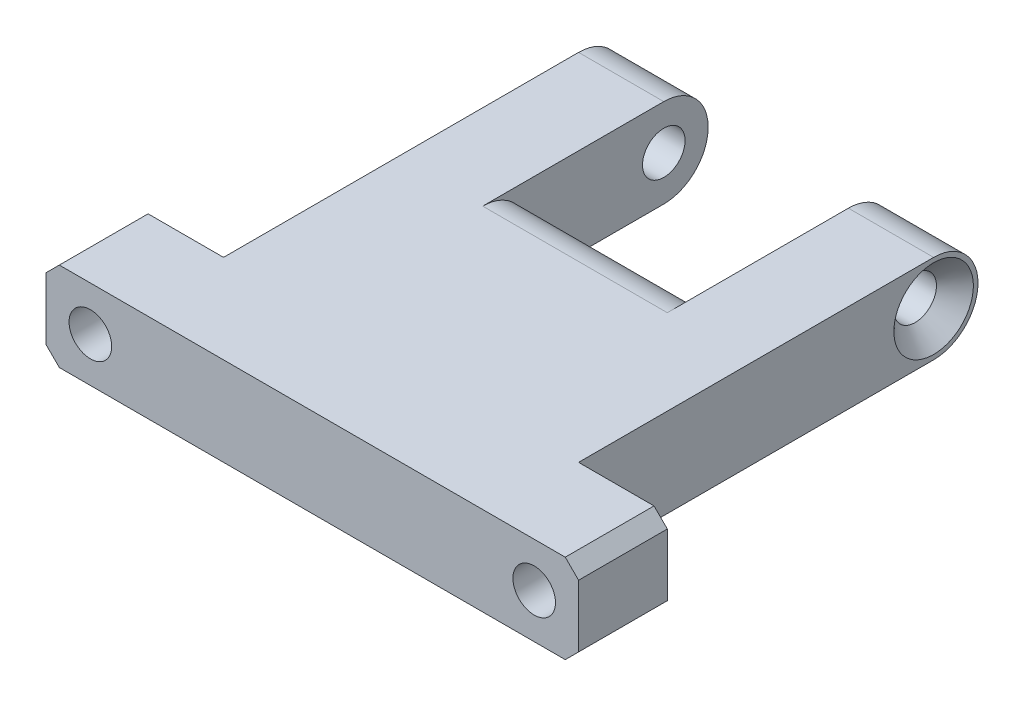
from build123d import *

# Parameters (mm, degrees)
BOSS_EXTRUDE1_DEPTH           = 10
FILLET1_R                     = 5
CHAMFER1_SIZE                 = 1.5
CSK_FOR_M4_SFHCS1_D           = 4.8
CSK_FOR_M4_SFHCS1_CSINK_D     = 8.96
CSK_FOR_M4_SFHCS1_CSINK_ANGLE = 90
CSK_FOR_M4_SFHCS2_D           = 4.8
CSK_FOR_M4_SFHCS2_DEPTH       = 9.6
CSK_FOR_M4_SFHCS2_CSINK_D     = 8.96
CSK_FOR_M4_SFHCS2_CSINK_ANGLE = 90


with BuildPart() as part:
    # Sketch1 → Boss-Extrude1 (new body)
    with BuildSketch(Plane(origin=(0, 0, 0), x_dir=(1, 0, 0), z_dir=(0, 1, 0))):
        Polygon((-30, -17.5), (-30, -27.5), (30, -27.5), (30, -17.5), (20, -17.5), (20, 27.5), (10.4, 27.5), (10.4, 7.1), (-10.4, 7.1), (-10.4, 27.5), (-20, 27.5), (-20, -17.5), align=None)
    extrude(amount=BOSS_EXTRUDE1_DEPTH)

    # Fillet1
    fillet1_edges = [part.edges().sort_by_distance(p)[0] for p in [
        (-15.2, 0, -27.5),
        (15.2, 0, -27.5),
        (-15.2, 10, -27.5),
        (15.2, 10, -27.5),
        (0, 10, -7.1),
        (0, 0, -7.1),
    ]]
    fillet(fillet1_edges, radius=FILLET1_R - 0.0001)  # a hair under: the kernel refuses the full size

    # Chamfer1
    chamfer1_edges = [part.edges().sort_by_distance(p)[0] for p in [
        (30, 0, 22.5),
        (-30, 0, 22.5),
        (-30, 10, 22.5),
        (30, 10, 22.5),
    ]]
    chamfer(chamfer1_edges, length=CHAMFER1_SIZE)

    # CSK for M4 SFHCS1 (through all)
    with Locations(Plane(origin=(0, 0, 17.5), x_dir=(-1, 0, 0), z_dir=(0, 0, -1))):
        with Locations((-25, 5), (25, 5)):
            CounterSinkHole(CSK_FOR_M4_SFHCS1_D / 2, CSK_FOR_M4_SFHCS1_CSINK_D / 2, counter_sink_angle=CSK_FOR_M4_SFHCS1_CSINK_ANGLE)

    # CSK for M4 SFHCS2
    with Locations(Plane.ZY.offset(20)):
        with Locations((-22.5, 5)):
            csk_for_m4_sfhcs2 = CounterSinkHole(CSK_FOR_M4_SFHCS2_D / 2, CSK_FOR_M4_SFHCS2_CSINK_D / 2, depth=CSK_FOR_M4_SFHCS2_DEPTH, counter_sink_angle=CSK_FOR_M4_SFHCS2_CSINK_ANGLE)

    # Mirror1: CSK for M4 SFHCS2 across plane
    add(csk_for_m4_sfhcs2.mirror(Plane(origin=(0, 0, 0), x_dir=(0, 0, 1), z_dir=(1, 0, 0))), mode=Mode.SUBTRACT)


solid = part.part
